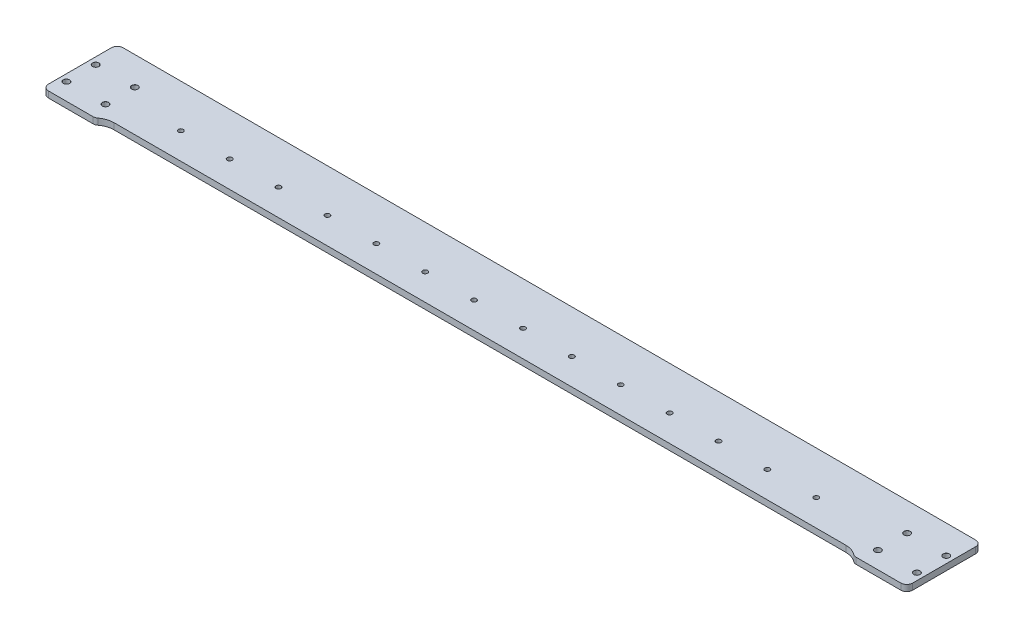
from build123d import *

# Parameters (mm, degrees)
BOSS_EXTRUDE1_DEPTH                   = 3.175
M3_CLEARANCE_HOLE1_D                  = 3.2
M3_CLEARANCE_HOLE1_CSINK_D            = 3.25
M3_CLEARANCE_HOLE1_CSINK_ANGLE        = 90
FILLET1_R                             = 10
FILLET2_R                             = 3
TAP_DRILL_FOR_M3X0_5_TAP2_D           = 2.5
TAP_DRILL_FOR_M3X0_5_TAP2_CSINK_D     = 2.55
TAP_DRILL_FOR_M3X0_5_TAP2_CSINK_ANGLE = 90
LPATTERN1_COUNT                       = 14
LPATTERN1_PITCH                       = 25


with BuildPart() as part:
    # Sketch1 → Boss-Extrude1 (new body)
    with BuildSketch(Plane(origin=(0, 0, 0), x_dir=(1, 0, 0), z_dir=(0, 1, 0))):
        Polygon((0, 0), (194, 0), (194, -2.7), (221, -2.7), (221, 29.7), (221, 35.5), (0, 35.5), (0, 29.7), align=None)
    extrude(amount=BOSS_EXTRUDE1_DEPTH)

    # M3 Clearance Hole1 (through all)
    with Locations(Plane(origin=(0, 3.175, 0), x_dir=(1, 0, 0), z_dir=(0, 1, 0))):
        with Locations((197.5, 21), (217.5, 6), (217.5, 21), (197.5, 6)):
            CounterSinkHole(M3_CLEARANCE_HOLE1_D / 2, M3_CLEARANCE_HOLE1_CSINK_D / 2, counter_sink_angle=M3_CLEARANCE_HOLE1_CSINK_ANGLE)

    # Fillet1
    # the kernel refuses this fillet: 10 mm, written as the material it adds along each edge
    with BuildSketch(Plane(origin=(194, 0, 0), x_dir=(-1, 0, 0), z_dir=(0, 1, 0))) as fillet1_piece_1:
        with BuildLine():
            CenterArc((6.83447145, 10), FILLET1_R, 226.886394054, 43.113605946)
            Line((0, 2.7), (-0.136689429, 2.554))
            ThreePointArc((-0.136689429, 2.554), (-0.2, 1.35), (-0.2, 0))
            Line((-0.2, 0), (0, -0.2))
            Line((0, -0.2), (6.83447145, -0.2))
            Line((6.83447145, -0.2), (6.83447145, 0))
        make_face()
    extrude(amount=3.175)

    # Fillet2
    fillet2_edges = [part.edges().sort_by_distance(p)[0] for p in [
        (221, 1.5875, -35.5),
        (221, 1.5875, 2.7),
        (194, 1.5875, 2.7),
    ]]
    fillet(fillet2_edges, radius=FILLET2_R)

    # Mirror1: part across plane


with BuildPart() as part_1:
    add(part.part)
    add(part.part.mirror(Plane(origin=(0, 3.175, -35.5), x_dir=(0, 0, 1), z_dir=(1, 0, 0))))

    # Tap Drill for M3x0.5 Tap2 (through all)
    with Locations(Plane(origin=(0, 0, 0), x_dir=(-1, 0, 0), z_dir=(0, -1, 0))):
        with Locations((166.5, 13.5)):
            tap_drill_for_m3x0_5_tap2 = CounterSinkHole(TAP_DRILL_FOR_M3X0_5_TAP2_D / 2, TAP_DRILL_FOR_M3X0_5_TAP2_CSINK_D / 2, counter_sink_angle=TAP_DRILL_FOR_M3X0_5_TAP2_CSINK_ANGLE)

    # LPattern1: Tap Drill for M3x0.5 Tap2 ×14
    with Locations(*[(i * LPATTERN1_PITCH, 0, 0) for i in range(1, LPATTERN1_COUNT)]):
        add(tap_drill_for_m3x0_5_tap2, mode=Mode.SUBTRACT)


solid = part_1.part
